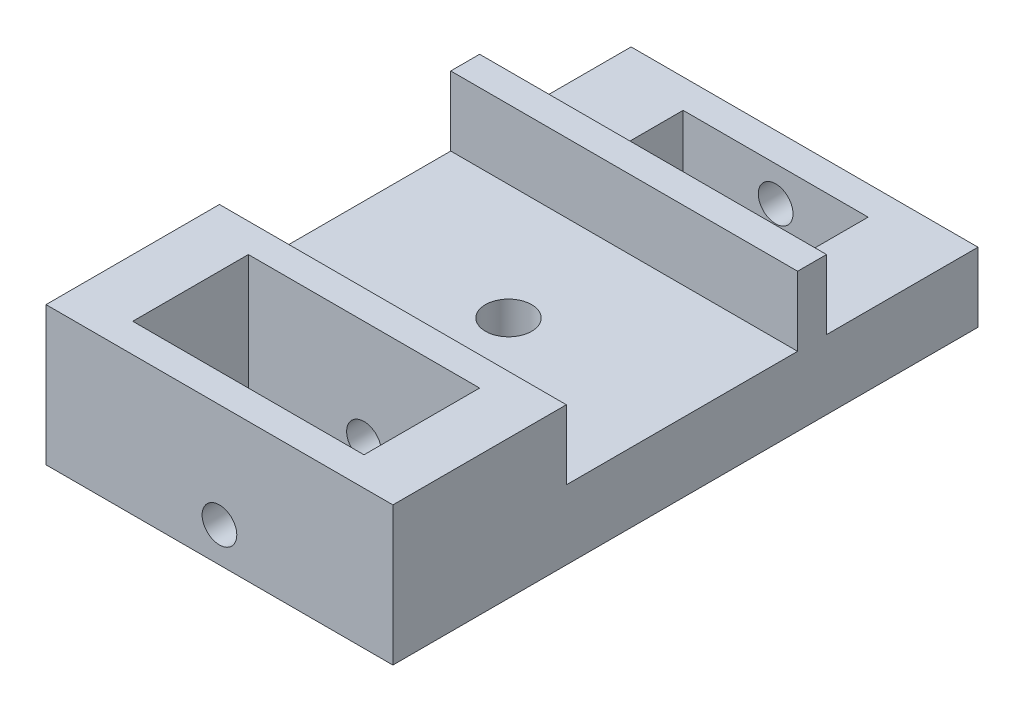
from build123d import *

# Parameters (mm, degrees)
SKETCH1_W           = 30
SKETCH1_H           = 38.1
SKETCH1_W_2         = 16
SKETCH1_H_2         = 10.6
BOSS_EXTRUDE1_DEPTH = 6
SKETCH1_3_W         = 30
SKETCH1_3_H         = 2.5
BOSS_EXTRUDE2_DEPTH = 12
SKETCH3_R           = 1.5
CUT_EXTRUDE2_DEPTH  = 16
SKETCH2_R           = 2
CUT_EXTRUDE1_DEPTH  = 38.976966704
BOSS_EXTRUDE3_DEPTH = 12
CUT_EXTRUDE4_START  = -20
SKETCH6_R           = 1.5
CUT_EXTRUDE4_DEPTH  = 20


with BuildPart() as part:
    # Sketch1 → Boss-Extrude1 (new body)
    with BuildSketch(Plane(origin=(0, 0, 0), x_dir=(1, 0, 0), z_dir=(0, 1, 0))):
        with Locations((-15, -3.45)):
            Rectangle(SKETCH1_W, SKETCH1_H)
        with Locations((-15, 7.8)):
            Rectangle(SKETCH1_W_2, SKETCH1_H_2, mode=Mode.SUBTRACT)
    extrude(amount=BOSS_EXTRUDE1_DEPTH)

    # Sketch1<3> → Boss-Extrude2 (add)
    with BuildSketch(Plane(origin=(0, 0, 0), x_dir=(1, 0, 0), z_dir=(0, 1, 0))):
        with Locations((-15, -21.25)):
            Rectangle(SKETCH1_3_W, SKETCH1_3_H)
        with Locations((-15, 1.25)):
            Rectangle(SKETCH1_3_W, SKETCH1_3_H)
    extrude(amount=BOSS_EXTRUDE2_DEPTH)

    # Sketch3 → Cut-Extrude2 (cut)
    with BuildSketch(Plane(origin=(0, 0, -15.6), x_dir=(-1, 0, 0), z_dir=(0, 0, -1))):
        with Locations((15, 3)):
            Circle(SKETCH3_R)
    extrude(amount=-CUT_EXTRUDE2_DEPTH, mode=Mode.SUBTRACT)

    # Sketch2 → Cut-Extrude1 (cut, through all)
    with BuildSketch(Plane(origin=(0, 6, 0), x_dir=(1, 0, 0), z_dir=(0, 1, 0))):
        with Locations((-15, -10)):
            Circle(SKETCH2_R)
    extrude(amount=-CUT_EXTRUDE1_DEPTH, mode=Mode.SUBTRACT)

    # Sketch5 → Boss-Extrude3 (add)
    with BuildSketch(Plane.XZ):
        Polygon((-30, 22.5), (-25, 22.5), (-25, 32.5), (-5, 32.5), (-5, 22.5), (0, 22.5), (0, 35), (-30, 35), align=None)
    extrude(amount=-BOSS_EXTRUDE3_DEPTH)

    # Sketch6 → Cut-Extrude4 (cut)
    with BuildSketch(Plane.XY.offset(35).offset(CUT_EXTRUDE4_START)):
        with Locations((-15, 3)):
            Circle(SKETCH6_R)
    extrude(amount=CUT_EXTRUDE4_DEPTH, mode=Mode.SUBTRACT)


solid = part.part
